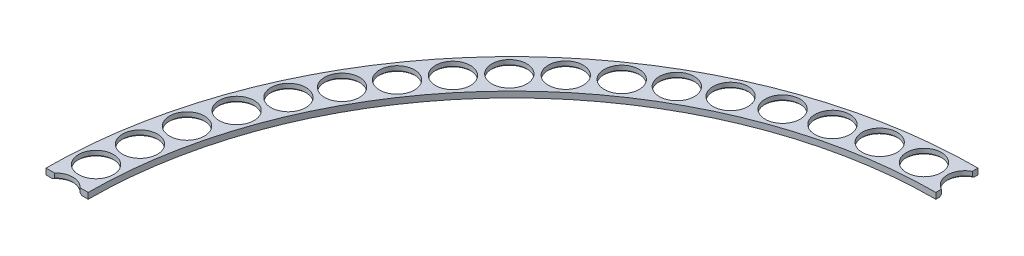
from build123d import *

# Parameters (mm, degrees)
ESQUISSE1_R                               = 156.21
ESQUISSE1_R_2                             = 142.07
BOSS_EXTRU_1_DEPTH                        = 2
ESQUISSE2_R                               = 5.85
ENL_V_MAT_EXTRU_1_DEPTH                   = 2
CHANFREIN1_SIZE                           = 0.5
R_P_TITION_CIRCULAIRE1_COUNT              = 70
CHANFREIN1_OF_R_P_TITION_CIRCULAIRE1_SIZE = 0.5
INTERSECT4_OUTLINE_R                      = 5.85
INTERSECT4_DEPTH                          = 2


# Read off the part's stored shape, not the designer's step: Intersect4
with BuildPart() as part:
    # Esquisse1 → Boss.-Extru.1 (new body)
    with BuildSketch(Plane(origin=(0, 0, 0), x_dir=(1, 0, 0), z_dir=(0, 1, 0))):
        with Locations(Location((0, 0, 0), (0, 0, 270))):
            Circle(ESQUISSE1_R)
        with Locations(Location((0, 0, 0), (0, 0, 270))):
            Circle(ESQUISSE1_R_2, mode=Mode.SUBTRACT)
    extrude(amount=BOSS_EXTRU_1_DEPTH)

    # Esquisse2 → Enlèv. mat.-Extru.1 (cut)
    with BuildSketch(Plane.XZ):
        with Locations(Location((-138.182447366, 56.110162301, 0), (0, 0, 270))):
            Circle(ESQUISSE2_R)
    enl_v_mat_extru_1 = extrude(amount=-ENL_V_MAT_EXTRU_1_DEPTH, mode=Mode.SUBTRACT)

    # Chanfrein1
    chanfrein1_edges = [part.edges().sort_by_distance(p)[0] for p in [
        (-138.182447366, 0, 61.960162301),
    ]]
    chamfer(chanfrein1_edges, length=CHANFREIN1_SIZE)

    # Répétition circulaire1: Enlèv. mat.-Extru.1 ×70 about axis
    r_p_tition_circulaire1_axis = Axis((0, 0, 0), (0, 1, 0))
    for i in range(1, R_P_TITION_CIRCULAIRE1_COUNT):
        add(enl_v_mat_extru_1.rotate(r_p_tition_circulaire1_axis, i * 360 / R_P_TITION_CIRCULAIRE1_COUNT), mode=Mode.SUBTRACT)

    # Chanfrein1 of Répétition circulaire1
    chanfrein1_of_r_p_tition_circulaire1_edges = [part.edges().sort_by_distance(p)[0] for p in [
        (-132.07209933, 0, 74.097307988),
        (-124.898384407, 0, 85.63786572),
        (-116.719061132, 0, 96.488917711),
        (-107.599984606, 0, 106.563097671),
        (-97.614576272, 0, 115.779294227),
        (-86.843232766, 0, 124.063303983),
        (-75.372678613, 0, 131.348428963),
        (-63.295267971, 0, 137.576013625),
        (-50.708241047, 0, 142.695917119),
        (-37.712941183, 0, 146.666916991),
        (-24.413998891, 0, 149.457041087),
        (-10.918489435, 0, 151.043824968),
        (2.664929277, 0, 151.414492782),
        (16.226891547, 0, 150.56606013),
        (29.658204426, 0, 148.505358094),
        (42.850726883, 0, 145.248978234),
        (55.698240482, 0, 140.823139006),
        (68.097304599, 0, 135.263474666),
        (79.94808926, 0, 128.614748362),
        (91.155178915, 0, 120.930491727),
        (101.628340667, 0, 112.27257388),
        (111.283250778, 0, 102.710703283),
        (120.042173586, 0, 92.321866495),
        (127.834587396, 0, 81.189708324),
        (134.597752274, 0, 69.403858359),
        (140.277215193, 0, 57.059209336),
        (144.827248457, 0, 44.255153109),
        (148.211217874, 0, 31.094780412),
        (150.40187771, 0, 17.684050826),
        (151.381590063, 0, 4.13093966),
        (151.142466863, 0, -9.455431402),
        (149.68643339, 0, -22.965672891),
        (147.02521277, 0, -36.291008285),
        (143.180231586, 0, -49.324149819),
        (138.182447366, 0, -61.960162301),
        (132.07209933, 0, -74.097307988),
        (124.898384407, 0, -85.63786572),
        (116.719061132, 0, -96.488917711),
        (107.599984606, 0, -106.563097671),
        (97.614576272, 0, -115.779294227),
        (86.843232766, 0, -124.063303983),
        (75.372678613, 0, -131.348428963),
        (63.295267971, 0, -137.576013625),
        (50.708241047, 0, -142.695917119),
        (37.712941183, 0, -146.666916991),
        (24.413998891, 0, -149.457041087),
        (10.918489435, 0, -151.043824968),
        (-2.664929277, 0, -151.414492782),
        (-16.226891547, 0, -150.56606013),
        (-29.658204426, 0, -148.505358094),
        (-42.850726883, 0, -145.248978234),
        (-55.698240482, 0, -140.823139006),
        (-68.097304599, 0, -135.263474666),
        (-79.94808926, 0, -128.614748362),
        (-91.155178915, 0, -120.930491727),
        (-101.628340667, 0, -112.27257388),
        (-111.283250778, 0, -102.710703283),
        (-120.042173586, 0, -92.321866495),
        (-127.834587396, 0, -81.189708324),
        (-134.597752274, 0, -69.403858359),
        (-140.277215193, 0, -57.059209336),
        (-144.827248457, 0, -44.255153109),
        (-148.211217874, 0, -31.094780412),
        (-150.40187771, 0, -17.684050826),
        (-151.381590063, 0, -4.13093966),
        (-151.142466863, 0, 9.455431402),
        (-149.68643339, 0, 22.965672891),
        (-147.02521277, 0, 36.291008285),
        (-143.180231586, 0, 49.324149819),
    ]]
    chamfer(chanfrein1_of_r_p_tition_circulaire1_edges, length=CHANFREIN1_OF_R_P_TITION_CIRCULAIRE1_SIZE)

    # Intersect4 outline → Intersect4 (cut)
    with BuildSketch(Plane(origin=(0, 0, 0), x_dir=(1, 0, 0), z_dir=(0, 1, 0))):
        with BuildLine():
            Line((0, 156.21), (0, 154.29748035))
            ThreePointArc((0, 154.29748035), (8.564308192, 149.115296347), (0, 143.933112344))
            Line((0, 143.933112344), (0, 142.07))
            ThreePointArc((0, 142.07), (100.458660403, -100.458660403), (-142.07, 0))
            Line((-142.07, 0), (-144.79805755, 0))
            ThreePointArc((-144.79805755, 0), (-149.086924142, -9.828457409), (-153.375790734, 0))
            Line((-153.375790734, 0), (-156.21, 0))
            ThreePointArc((-156.21, 0), (110.457150289, -110.457150289), (0, 156.21))
        make_face()
        with Locations((-89.843693539, -119.04137854)):
            Circle(INTERSECT4_OUTLINE_R, mode=Mode.SUBTRACT)
        with Locations((-78.811222339, -126.615679546)):
            Circle(INTERSECT4_OUTLINE_R, mode=Mode.SUBTRACT)
        with Locations((-118.275376678, -90.849734976)):
            Circle(INTERSECT4_OUTLINE_R, mode=Mode.SUBTRACT)
        with Locations((-125.942942241, -79.881877626)):
            Circle(INTERSECT4_OUTLINE_R, mode=Mode.SUBTRACT)
        with Locations((-100.152796146, -110.50862635)):
            Circle(INTERSECT4_OUTLINE_R, mode=Mode.SUBTRACT)
        with Locations((-109.655527327, -101.086123678)):
            Circle(INTERSECT4_OUTLINE_R, mode=Mode.SUBTRACT)
        with Locations((-54.936591001, -138.653200622)):
            Circle(INTERSECT4_OUTLINE_R, mode=Mode.SUBTRACT)
        with Locations((-42.286655355, -143.019501651)):
            Circle(INTERSECT4_OUTLINE_R, mode=Mode.SUBTRACT)
        with Locations((-67.144209517, -133.170545549)):
            Circle(INTERSECT4_OUTLINE_R, mode=Mode.SUBTRACT)
        with Locations((-29.296252425, -146.234293746)):
            Circle(INTERSECT4_OUTLINE_R, mode=Mode.SUBTRACT)
        with Locations((-16.069973297, -148.271693292)):
            Circle(INTERSECT4_OUTLINE_R, mode=Mode.SUBTRACT)
        with Locations((-2.714308192, -149.115296347)):
            Circle(INTERSECT4_OUTLINE_R, mode=Mode.SUBTRACT)
        with Locations((-132.596489287, -68.270858368)):
            Circle(INTERSECT4_OUTLINE_R, mode=Mode.SUBTRACT)
        with Locations((-138.182447366, -56.110162301)):
            Circle(INTERSECT4_OUTLINE_R, mode=Mode.SUBTRACT)
        with Locations((-142.655841629, -43.497700199)):
            Circle(INTERSECT4_OUTLINE_R, mode=Mode.SUBTRACT)
        with Locations((-145.980654936, -30.535020192)):
            Circle(INTERSECT4_OUTLINE_R, mode=Mode.SUBTRACT)
        with Locations((-148.130117844, -17.326490156)):
            Circle(INTERSECT4_OUTLINE_R, mode=Mode.SUBTRACT)
        with Locations((10.663210926, -148.758310713)):
            Circle(INTERSECT4_OUTLINE_R, mode=Mode.SUBTRACT)
        with Locations((23.95487614, -147.20361063)):
            Circle(INTERSECT4_OUTLINE_R, mode=Mode.SUBTRACT)
        with Locations((37.053670776, -144.463713629)):
            Circle(INTERSECT4_OUTLINE_R, mode=Mode.SUBTRACT)
        with Locations((49.854131043, -140.560679749)):
            Circle(INTERSECT4_OUTLINE_R, mode=Mode.SUBTRACT)
        with Locations((62.25319516, -135.525933924)):
            Circle(INTERSECT4_OUTLINE_R, mode=Mode.SUBTRACT)
        with Locations((74.151033153, -129.400012967)):
            Circle(INTERSECT4_OUTLINE_R, mode=Mode.SUBTRACT)
        with Locations((85.451850628, -122.232239191)):
            Circle(INTERSECT4_OUTLINE_R, mode=Mode.SUBTRACT)
        with Locations((96.064660047, -114.080323297)):
            Circle(INTERSECT4_OUTLINE_R, mode=Mode.SUBTRACT)
        with Locations((105.904013308, -105.009899718)):
            Circle(INTERSECT4_OUTLINE_R, mode=Mode.SUBTRACT)
        with Locations((114.890689725, -95.093998171)):
            Circle(INTERSECT4_OUTLINE_R, mode=Mode.SUBTRACT)
        with Locations((122.952333862, -84.412455665)):
            Circle(INTERSECT4_OUTLINE_R, mode=Mode.SUBTRACT)
        with Locations((130.024038102, -73.0512737)):
            Circle(INTERSECT4_OUTLINE_R, mode=Mode.SUBTRACT)
        with Locations((136.04886524, -61.101925832)):
            Circle(INTERSECT4_OUTLINE_R, mode=Mode.SUBTRACT)
        with Locations((140.97830691, -48.660621186)):
            Circle(INTERSECT4_OUTLINE_R, mode=Mode.SUBTRACT)
        with Locations((144.772674148, -35.827529829)):
            Circle(INTERSECT4_OUTLINE_R, mode=Mode.SUBTRACT)
        with Locations((147.401416938, -22.705976268)):
            Circle(INTERSECT4_OUTLINE_R, mode=Mode.SUBTRACT)
        with Locations((148.843370189, -9.401607537)):
            Circle(INTERSECT4_OUTLINE_R, mode=Mode.SUBTRACT)
        with Locations((149.086924142, 3.978457409)):
            Circle(INTERSECT4_OUTLINE_R, mode=Mode.SUBTRACT)
        with Locations((148.130117844, 17.326490156)):
            Circle(INTERSECT4_OUTLINE_R, mode=Mode.SUBTRACT)
        with Locations((145.980654936, 30.535020192)):
            Circle(INTERSECT4_OUTLINE_R, mode=Mode.SUBTRACT)
        with Locations((142.655841629, 43.497700199)):
            Circle(INTERSECT4_OUTLINE_R, mode=Mode.SUBTRACT)
        with Locations((138.182447366, 56.110162301)):
            Circle(INTERSECT4_OUTLINE_R, mode=Mode.SUBTRACT)
        with Locations((132.596489287, 68.270858368)):
            Circle(INTERSECT4_OUTLINE_R, mode=Mode.SUBTRACT)
        with Locations((16.069973297, 148.271693292)):
            Circle(INTERSECT4_OUTLINE_R, mode=Mode.SUBTRACT)
        with Locations((29.296252425, 146.234293746)):
            Circle(INTERSECT4_OUTLINE_R, mode=Mode.SUBTRACT)
        with Locations((67.144209517, 133.170545549)):
            Circle(INTERSECT4_OUTLINE_R, mode=Mode.SUBTRACT)
        with Locations((42.286655355, 143.019501651)):
            Circle(INTERSECT4_OUTLINE_R, mode=Mode.SUBTRACT)
        with Locations((54.936591001, 138.653200622)):
            Circle(INTERSECT4_OUTLINE_R, mode=Mode.SUBTRACT)
        with Locations((109.655527327, 101.086123678)):
            Circle(INTERSECT4_OUTLINE_R, mode=Mode.SUBTRACT)
        with Locations((100.152796146, 110.50862635)):
            Circle(INTERSECT4_OUTLINE_R, mode=Mode.SUBTRACT)
        with Locations((125.942942241, 79.881877626)):
            Circle(INTERSECT4_OUTLINE_R, mode=Mode.SUBTRACT)
        with Locations((118.275376678, 90.849734976)):
            Circle(INTERSECT4_OUTLINE_R, mode=Mode.SUBTRACT)
        with Locations((78.811222339, 126.615679546)):
            Circle(INTERSECT4_OUTLINE_R, mode=Mode.SUBTRACT)
        with Locations((89.843693539, 119.04137854)):
            Circle(INTERSECT4_OUTLINE_R, mode=Mode.SUBTRACT)
    extrude(amount=INTERSECT4_DEPTH, mode=Mode.SUBTRACT)


solid = part.part
